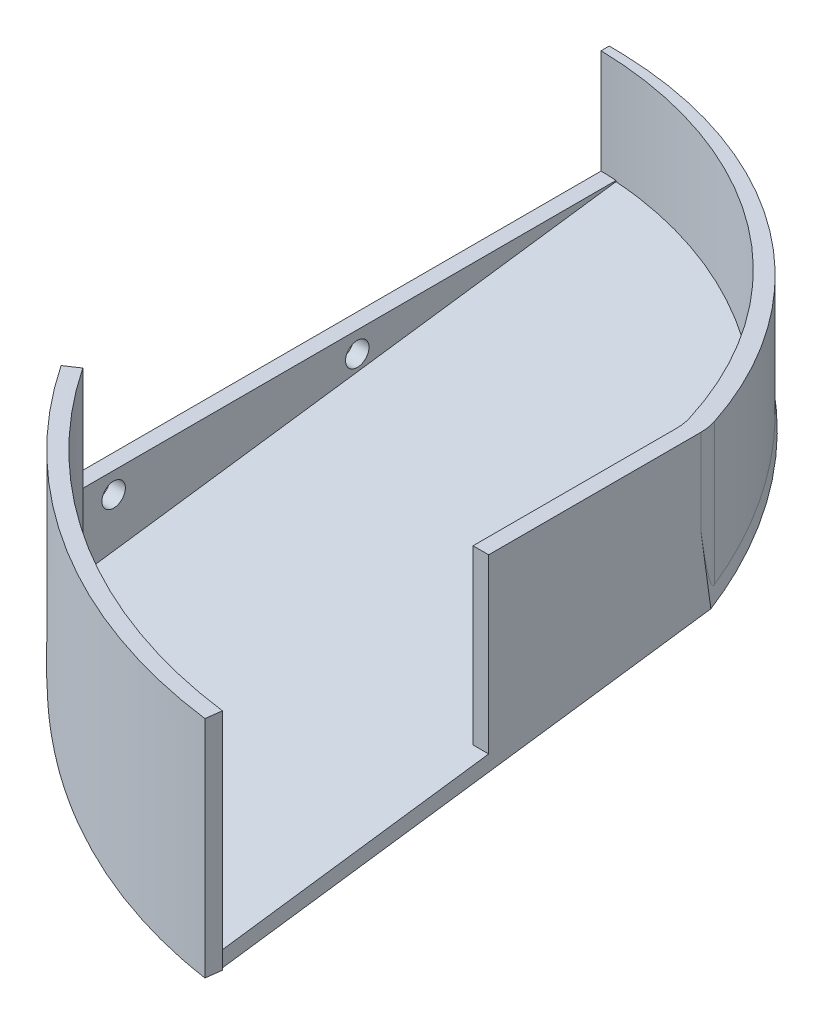
from build123d import *

# Parameters (mm, degrees)
BOSS_EXTRUDE1_DEPTH            = 3
SKETCH2_W                      = 70
SKETCH2_H                      = 151.595005295
BOSS_EXTRUDE2_DEPTH            = 3
BOSS_EXTRUDE3_DEPTH            = 20
BOSS_EXTRUDE3_DEPTH_BACK       = 30
CUT_EXTRUDE2_START             = -33
CUT_EXTRUDE2_DEPTH             = 33
CUT_EXTRUDE4_DEPTH             = 115
FILLET1_R                      = 10
FILLET2_R                      = 10
CUT_EXTRUDE6_REACH             = 171.695
SKETCH9_RX                     = 2.25
SKETCH9_RY                     = 2.229295084
CUT_EXTRUDE7_REACH             = 170.42
SKETCH10_R                     = 2.25
CUT_EXTRUDE8_REACH             = 170.259
CUT_EXTRUDE8_DIRECTION_2_DEPTH = 94
CUT_EXTRUDE10_DEPTH            = 103
CUT_EXTRUDE11_DEPTH            = 103


with BuildPart() as part:
    # Sketch1 → Boss-Extrude1 (new body)
    with BuildSketch(Plane(origin=(0, 0, 0), x_dir=(0, 0, -1), z_dir=(1, 0, 0))):
        Polygon((0, 0), (-150.2, -20.518421735), (-150.2, 3), (0, 3), align=None)
    extrude(amount=BOSS_EXTRUDE1_DEPTH)

    # Sketch2 → Boss-Extrude2 (add)
    with BuildSketch(Plane(origin=(0, 0, 0), x_dir=(1, 0, 0), z_dir=(0, -0.990797814924306, -0.1353502491361604))):
        with Locations((38, 75.797502648)):
            Rectangle(SKETCH2_W, SKETCH2_H)
    extrude(amount=-BOSS_EXTRUDE2_DEPTH)

    # Sketch5 → Boss-Extrude3 (add, two sides: drawn at the far end of the back side and taken through both)
    with BuildSketch(Plane(origin=(0, 3, 0), x_dir=(1, 0, 0), z_dir=(0, 1, 0)).offset(-BOSS_EXTRUDE3_DEPTH_BACK)):
        with BuildLine():
            Line((3, -104.05218158), (0.508313252, -105.722958989))
            ThreePointArc((0.508313252, -105.722958989), (31.90357912, -135.998781236), (73, -150.606050747))
            Line((73, -150.606050747), (73.384867861, -147.63084038))
            ThreePointArc((73.384867861, -147.63084038), (33.48282829, -133.448100531), (3, -104.05218158))
        make_face()
        with BuildLine():
            Line((70, -96.146550786), (73, -96.146550786))
            Line((73, -96.146550786), (73, -53.908597266))
            ThreePointArc((73, -53.908597266), (46.665766377, -15.719157646), (3, -0.059463978))
            Line((3, -0.059463978), (0, 0))
            Line((0, 0), (0, -1.572100517))
            ThreePointArc((0, -1.572100517), (43.8980516, -17.106077573), (70, -55.668127145))
            Line((70, -55.668127145), (70, -96.146550786))
        make_face()
    extrude(amount=BOSS_EXTRUDE3_DEPTH + BOSS_EXTRUDE3_DEPTH_BACK)

    # Sketch6 → Cut-Extrude2 (cut)
    with BuildSketch(Plane(origin=(0, 3, 0), x_dir=(1, 0, 0), z_dir=(0, 1, 0)).offset(CUT_EXTRUDE2_START)):
        with BuildLine():
            Line((0.508313252, -105.722958989), (0, -105.722958989))
            Line((0, -105.722958989), (0, -169.051425707))
            Line((0, -169.051425707), (84.981522018, -167.575878665))
            Line((84.981522018, -167.575878665), (85.31506111, -151.454848331))
            ThreePointArc((85.31506111, -151.454848331), (37.248522369, -139.090866233), (0.508313252, -105.722958989))
        make_face()
    extrude(amount=CUT_EXTRUDE2_DEPTH, mode=Mode.SUBTRACT)

    # Sketch8 → Cut-Extrude4 (cut)
    with BuildSketch(Plane(origin=(0, 2.972393445, 0.406050747), x_dir=(1, 0, 0), z_dir=(0, 0.9907978149243061, 0.1353502491361604))):
        with BuildLine():
            Line((8.157388122, 0), (3.866033028, 8.216650166))
            Line((3.866033028, 8.216650166), (75.705799011, 9.438735577))
            Line((75.705799011, 9.438735577), (81.706260282, -54.811535315))
            Line((81.706260282, -54.811535315), (73, -53.999459539))
            add(Edge.make_bspline(
                [(73, -53.999459539), (58.436791521, -5.155527194), (8.157388122, 0)],
                knots=[1.863103522, 1.863103522, 1.863103522, 3.040346046, 3.040346046, 3.040346046], degree=2, weights=[1, 0.831706965, 1]))
        make_face()
    extrude(amount=-CUT_EXTRUDE4_DEPTH, mode=Mode.SUBTRACT)

    # Fillet1
    fillet1_edges = [part.edges().sort_by_distance(p)[0] for p in [
        (70, 9.211594228, 55.668127145),
    ]]
    fillet(fillet1_edges, radius=FILLET1_R)

    # Fillet2
    fillet2_edges = [part.edges().sort_by_distance(p)[0] for p in [
        (73, 9.331776571, 53.908597266),
    ]]
    fillet(fillet2_edges, radius=FILLET2_R)

    # Sketch9 → Cut-Extrude6 (cut, up to next)
    with BuildSketch(Plane(origin=(0, 0, 0), x_dir=(1, 0, 0), z_dir=(0, -0.990797814924306, -0.13535024913616037)), mode=Mode.PRIVATE) as cut_extrude6_sk1:
        with Locations((61.74470656, 142.332101336)):
            Ellipse(SKETCH9_RX, SKETCH9_RY)
    cut_extrude6_tool1 = extrude(cut_extrude6_sk1.sketch, amount=-CUT_EXTRUDE6_REACH, mode=Mode.PRIVATE) & part.part
    add(cut_extrude6_tool1.solids().sort_by_distance((61.744707, -19.264685, 141.022335))[0], mode=Mode.SUBTRACT)

    # Sketch10 → Cut-Extrude7 (cut, up to next)
    with BuildSketch(Plane(origin=(3, 0, 0), x_dir=(0, 0, -1), z_dir=(1, 0, 0)), mode=Mode.PRIVATE) as cut_extrude7_sk1:
        with Locations((-98.132011667, -1)):
            Circle(SKETCH10_R)
    cut_extrude7_tool1 = extrude(cut_extrude7_sk1.sketch, amount=-CUT_EXTRUDE7_REACH, mode=Mode.PRIVATE) & part.part
    # Sketch10 → Cut-Extrude7 (cut, up to next)
    with BuildSketch(Plane(origin=(3, 0, 0), x_dir=(0, 0, -1), z_dir=(1, 0, 0)), mode=Mode.PRIVATE) as cut_extrude7_sk2:
        with Locations((-51.366561707, -1)):
            Circle(SKETCH10_R)
    cut_extrude7_tool2 = extrude(cut_extrude7_sk2.sketch, amount=-CUT_EXTRUDE7_REACH, mode=Mode.PRIVATE) & part.part
    add(cut_extrude7_tool1.solids().sort_by_distance((3, -1, 98.132012))[0], mode=Mode.SUBTRACT)
    add(cut_extrude7_tool2.solids().sort_by_distance((3, -1, 51.366562))[0], mode=Mode.SUBTRACT)

    # Sketch11 → Cut-Extrude8 (cut, up to next)
    with BuildSketch(Plane.ZY.offset(-70), mode=Mode.PRIVATE) as cut_extrude8_sk1:
        Polygon((1.572100517, -0.214760462), (55.668127145, -7.6046745), (96.146550786, -13.134324084), (96.146550786, -41.889826019), (-9.48276517, -44.187208781), (-10.51145645, 3.110071472), align=None)
    cut_extrude8_tool1 = extrude(cut_extrude8_sk1.sketch, amount=-CUT_EXTRUDE8_REACH, mode=Mode.PRIVATE) & part.part
    add(cut_extrude8_tool1.solids().sort_by_distance((70, -24.126117, 38.967625))[0], mode=Mode.SUBTRACT)

    # Sketch11 → Cut-Extrude8 direction 2 (cut)
    with BuildSketch(Plane.ZY.offset(-70)):
        Polygon((1.572100517, -0.214760462), (55.668127145, -7.6046745), (96.146550786, -13.134324084), (96.146550786, -41.889826019), (-9.48276517, -44.187208781), (-10.51145645, 3.110071472), align=None)
    extrude(amount=CUT_EXTRUDE8_DIRECTION_2_DEPTH, mode=Mode.SUBTRACT)

    # Sketch13 → Cut-Extrude10 (cut)
    with BuildSketch(Plane(origin=(49.061037193, 0, 73.166380855), x_dir=(-0.8305622493340057, 0, 0.556925802940784), z_dir=(-0.556925802940784, 0, -0.8305622493340057))):
        with BuildLine():
            add(Edge.make_bspline(
                [(21.560230981, -20.160551034), (55.065377745, -19.353871971), (55.453871297, -14.312852969)],
                knots=[2.302685869, 2.302685869, 2.302685869, 3.141335194, 3.141335194, 3.141335194], degree=2, weights=[1, 0.912467114, 0.998151378]))
            Line((21.560230981, -20.160551034), (25.058225156, -40.816273576))
            Line((25.058225156, -40.816273576), (81.118244806, -31.322651564))
            Line((81.118244806, -31.322651564), (73.698165968, -14.214291239))
            Line((73.698165968, -14.214291239), (55.453871297, -14.312852969))
        make_face()
    extrude(amount=-CUT_EXTRUDE10_DEPTH, mode=Mode.SUBTRACT)

    # Sketch14 → Cut-Extrude11 (cut)
    with BuildSketch(Plane(origin=(90.960043904, 0, 11.766427665), x_dir=(0.12828928714903373, 0, -0.9917367890739925), z_dir=(0.9917367890739925, 0, 0.12828928714903373))):
        Polygon((-139.629189391, -20.122955404), (-133.475097378, -20.122955404), (-133.475097378, -31.457099509), (-143.175056738, -29.840591421), align=None)
    extrude(amount=-CUT_EXTRUDE11_DEPTH, mode=Mode.SUBTRACT)


solid = part.part
